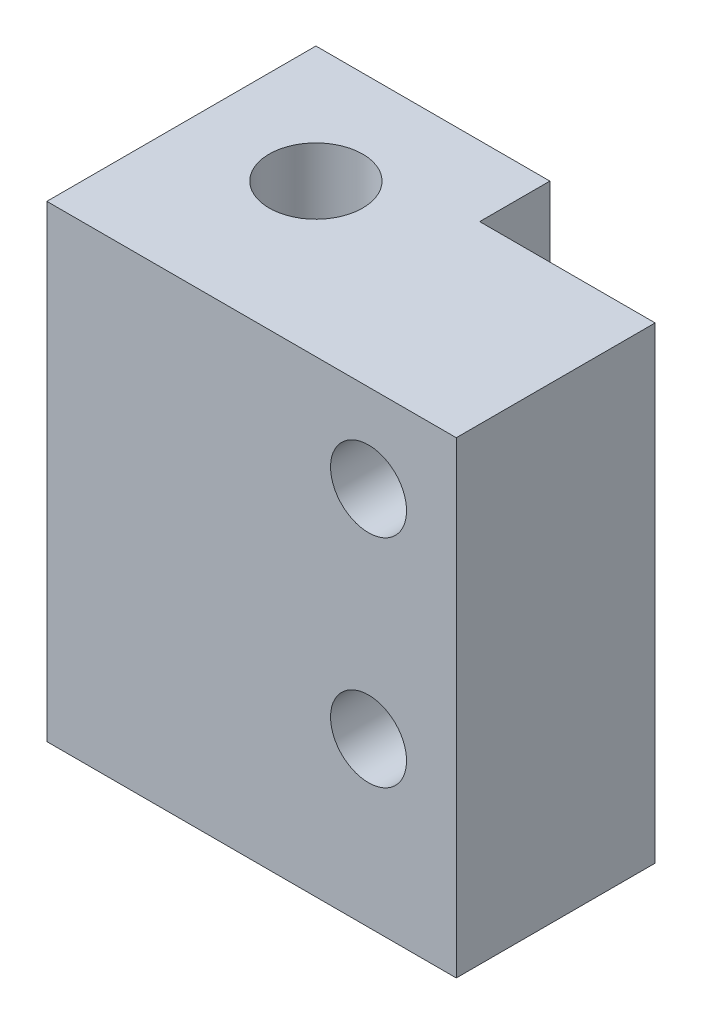
from build123d import *

# Parameters (mm, degrees)
BOSS_EXTRUDE2_DEPTH = 40
SKETCH3_R           = 4
CUT_EXTRUDE1_DEPTH  = 35
CUT_EXTRUDE2_REACH  = 52.14
SKETCH4_R           = 3.25


with BuildPart() as part:
    # Sketch1 → Boss-Extrude2 (new body)
    with BuildSketch(Plane(origin=(0, 0, 0), x_dir=(1, 0, 0), z_dir=(0, 1, 0))):
        Polygon((-10, -5.257459708), (-10, 0.742540292), (10, 0.742540292), (10, -5.257459708), (25, -5.257459708), (25, -22.257459708), (-10, -22.257459708), align=None)
    extrude(amount=BOSS_EXTRUDE2_DEPTH)

    # Sketch3 → Cut-Extrude1 (cut)
    with BuildSketch(Plane.XZ):
        with Locations((0, 9.257459708)):
            Circle(SKETCH3_R)
    extrude(amount=-CUT_EXTRUDE1_DEPTH, mode=Mode.SUBTRACT)

    # Sketch4 → Cut-Extrude2 (cut, up to next)
    with BuildSketch(Plane(origin=(0, 0, 5.257459708), x_dir=(-1, 0, 0), z_dir=(0, 0, -1)), mode=Mode.PRIVATE) as cut_extrude2_sk1:
        with Locations((-17.5, 26.045770547)):
            Circle(SKETCH4_R)
    cut_extrude2_tool1 = extrude(cut_extrude2_sk1.sketch, amount=-CUT_EXTRUDE2_REACH, mode=Mode.PRIVATE) & part.part
    # Sketch4 → Cut-Extrude2 (cut, up to next)
    with BuildSketch(Plane(origin=(0, 0, 5.257459708), x_dir=(-1, 0, 0), z_dir=(0, 0, -1)), mode=Mode.PRIVATE) as cut_extrude2_sk2:
        with Locations((-17.5, 7.535290978)):
            Circle(SKETCH4_R)
    cut_extrude2_tool2 = extrude(cut_extrude2_sk2.sketch, amount=-CUT_EXTRUDE2_REACH, mode=Mode.PRIVATE) & part.part
    add(cut_extrude2_tool1.solids().sort_by_distance((17.5, 26.045771, 5.25746))[0], mode=Mode.SUBTRACT)
    add(cut_extrude2_tool2.solids().sort_by_distance((17.5, 7.535291, 5.25746))[0], mode=Mode.SUBTRACT)


with BuildPart() as body_2:
    # Mirror4: mirrored copy
    add(part.part.mirror(Plane.ZX))


solid = body_2.part
